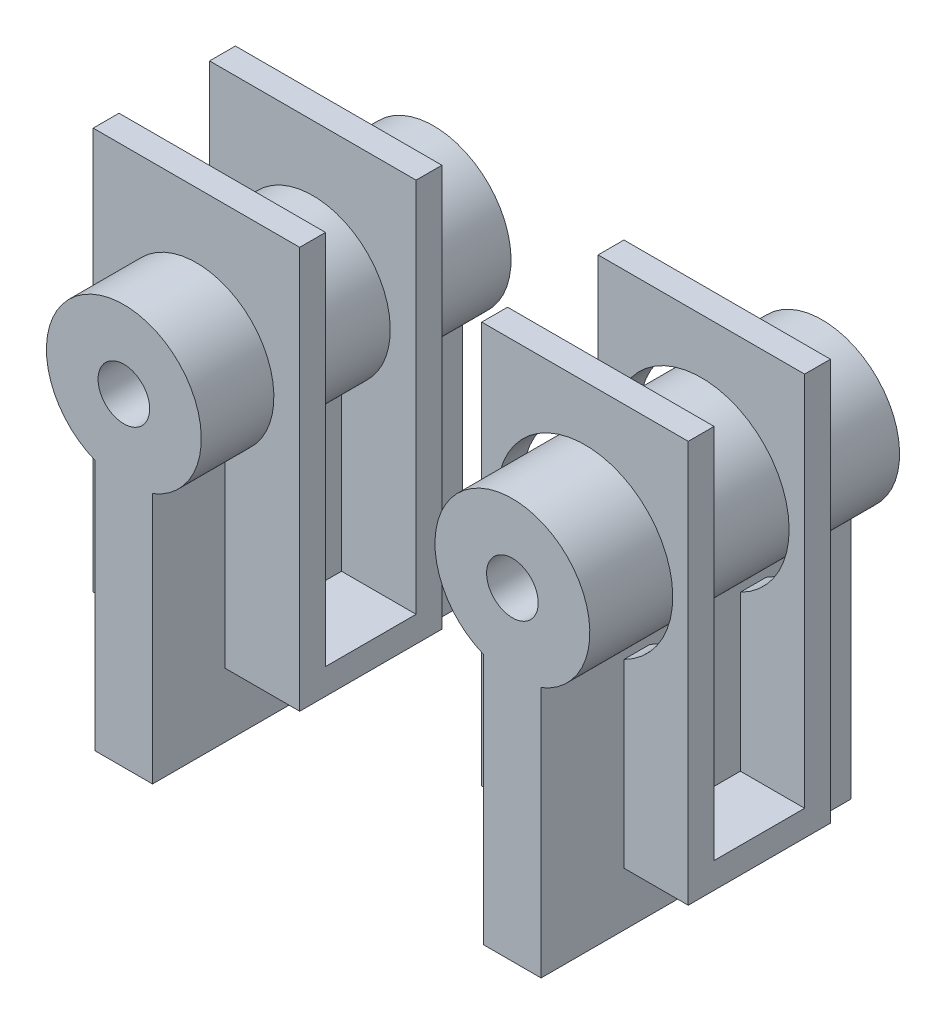
from build123d import *

# Parameters (mm, degrees)
EXTRUDE_5_DEPTH      = 30
EXTRUDE_5_DEPTH_BACK = 30
F_1_FR_R             = 5
EXTRUDE_6_DEPTH      = 20
EXTRUDE_6_DEPTH_BACK = 20
OTHER_START          = -11.605501957
OTHER_1_DEPTH        = 27.543632219
OTHER_START_2        = 10.938130262
OTHER_1_2_OUTLINE_R  = 3
OTHER_1_2_DEPTH      = 5
OTHER_1_3_OUTLINE_R  = 3
OTHER_1_3_DEPTH      = 5
THIS1_2_START        = -60.64972081
THIS1_2_OUTLINE_W    = 40
THIS1_2_OUTLINE_H    = 5
THIS1_2_DEPTH        = 77.833611116
THIS1_2_2_OUTLINE_W  = 40
THIS1_2_2_OUTLINE_H  = 17.543632218
THIS1_2_2_DEPTH      = 5
THIS1_2_START_2      = -35.308248488
THIS1_2_3_OUTLINE_R  = 5
THIS1_2_3_DEPTH      = 60


# Read off the part's stored shape, not the designer's step: Отступ1, this1_2
with BuildPart() as part:
    # Эскиз1_fr → Бобышка-Вытянуть5 (new, two sides: drawn at the far end of the back side and taken through both)
    with BuildSketch(Plane.XY.offset(-EXTRUDE_5_DEPTH_BACK)):
        with BuildLine():
            Line((-5.557606452, -13.932444528), (-5.557606452, -62.642280008))
            Line((-5.557606452, -62.642280008), (5.557606452, -62.642280008))
            Line((5.557606452, -62.642280008), (5.557606452, -13.932444528))
            ThreePointArc((5.557606452, -13.932444528), (0, 15), (-5.557606452, -13.932444528))
        make_face()
        Circle(F_1_FR_R, mode=Mode.SUBTRACT)
    extrude(amount=EXTRUDE_5_DEPTH + EXTRUDE_5_DEPTH_BACK)


with BuildPart() as body_2:
    # Эскиз3 → Бобышка-Вытянуть6 (new, two sides: drawn at the far end of the back side and taken through both)
    with BuildSketch(Plane(origin=(0, 0, 0), x_dir=(0, 0, -1), z_dir=(1, 0, 0)).offset(-EXTRUDE_6_DEPTH_BACK)):
        Polygon((-58.394498043, -50.25314581), (-85.938130262, -50.25314581), (-85.938130262, 27.580465306), (-80.938130262, 27.580465306), (-80.938130262, -45.25314581), (-63.394498043, -45.25314581), (-63.394498043, 27.580465306), (-58.394498043, 27.580465306), align=None)
    extrude(amount=EXTRUDE_6_DEPTH + EXTRUDE_6_DEPTH_BACK)


with BuildPart() as body_2_1:
    # Move Body 1: moved
    add(body_2.part.moved(Location((0, 0, -70))))

    # Отступ1 outline → Отступ1 (cut)
    with BuildSketch(Plane.XY.offset(OTHER_START)):
        with BuildLine():
            ThreePointArc((7.557606452, -15.227691378), (0, 17), (-7.557606452, -15.227691378))
            Line((-7.557606452, -15.227691378), (-7.557606452, -50.25314581))
            Line((-7.557606452, -50.25314581), (7.557606452, -50.25314581))
            Line((7.557606452, -50.25314581), (7.557606452, -15.227691378))
        make_face()
    extrude(amount=OTHER_1_DEPTH, mode=Mode.SUBTRACT)


with BuildPart() as body_3:
    # Other 1 2 outline → Other 1 2 (new body)
    with BuildSketch(Plane.XY.offset(OTHER_START_2)):
        Circle(OTHER_1_2_OUTLINE_R)
    extrude(amount=OTHER_1_2_DEPTH)


with BuildPart() as body_4:
    # Other 1 3 outline → Other 1 3 (new body)
    with BuildSketch(Plane.XY.offset(OTHER_START)):
        Circle(OTHER_1_3_OUTLINE_R)
    extrude(amount=OTHER_1_3_DEPTH)


with BuildPart() as body_5:
    # this1_2 outline → this1_2 (new body)
    with BuildSketch(Plane(origin=(0, 0, 0), x_dir=(1, 0, 0), z_dir=(0, 1, 0)).offset(THIS1_2_START)):
        with Locations((-80.569124199, 14.413750445)):
            Rectangle(THIS1_2_OUTLINE_W, THIS1_2_OUTLINE_H)
        with Locations((-80.569124199, -8.129881773)):
            Rectangle(THIS1_2_OUTLINE_W, THIS1_2_OUTLINE_H)
    extrude(amount=THIS1_2_DEPTH)

    # this1_2 2 outline → this1_2 2 (add)
    with BuildSketch(Plane(origin=(0, 0, 0), x_dir=(1, 0, 0), z_dir=(0, 1, 0)).offset(THIS1_2_START)):
        with Locations((-80.569124199, 3.141934336)):
            Rectangle(THIS1_2_2_OUTLINE_W, THIS1_2_2_OUTLINE_H)
    extrude(amount=THIS1_2_2_DEPTH)


with BuildPart() as body_6:
    # this1_2 3 outline → this1_2 3 (new body)
    with BuildSketch(Plane.XY.offset(THIS1_2_START_2)):
        with BuildLine():
            Line((-75.011517747, -73.038855008), (-75.011517747, -24.329019528))
            ThreePointArc((-75.011517747, -24.329019528), (-80.569124199, 4.603425), (-86.126730651, -24.329019528))
            Line((-86.126730651, -24.329019528), (-86.126730651, -73.038855008))
            Line((-86.126730651, -73.038855008), (-75.011517747, -73.038855008))
        make_face()
        with Locations((-80.569124199, -10.396575)):
            Circle(THIS1_2_3_OUTLINE_R, mode=Mode.SUBTRACT)
    extrude(amount=THIS1_2_3_DEPTH)


solid = Compound([part.part, body_2_1.part, body_3.part, body_4.part, body_5.part, body_6.part])
